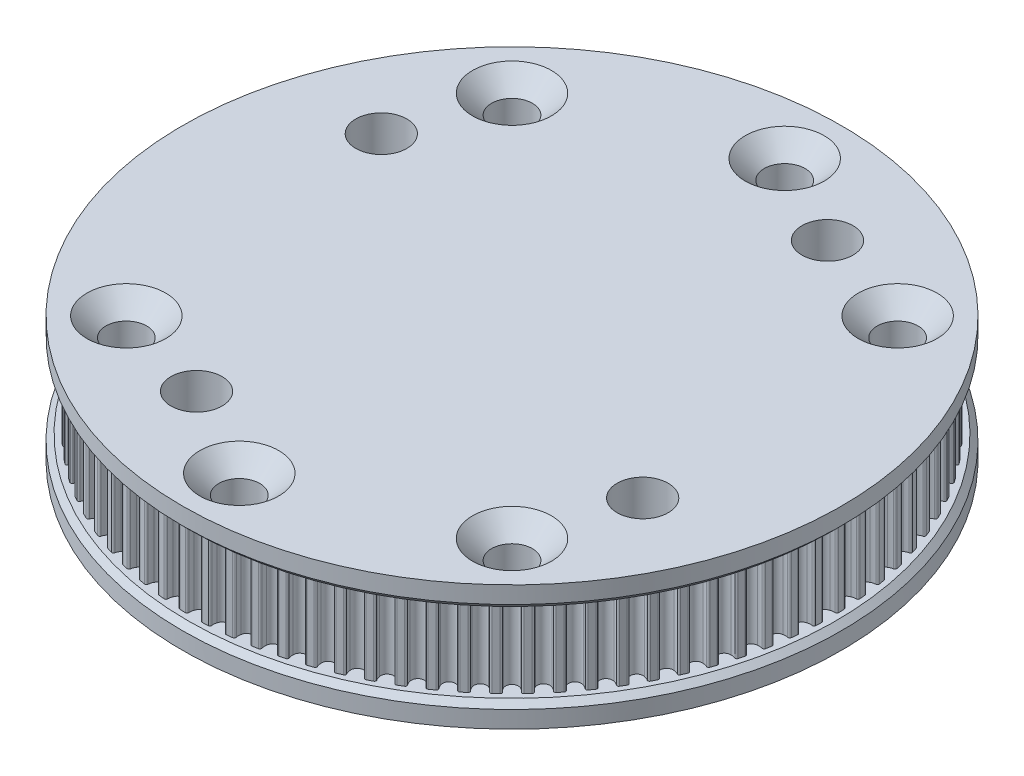
from build123d import *

# Parameters (mm, degrees)
SKETCH1_R                                            = 28.01
BOSS_EXTRUDE1_DEPTH                                  = 11
CSK_FOR_M3_HEX_SOCKET_COUNTERSUNK_HEAD_S_D           = 3.6
CSK_FOR_M3_HEX_SOCKET_COUNTERSUNK_HEAD_S_CSINK_D     = 6.94
CSK_FOR_M3_HEX_SOCKET_COUNTERSUNK_HEAD_S_CSINK_ANGLE = 90
F_4_5_4_5_DIAMETER_HOLE1_D                           = 4.5
CUT_EXTRUDE1_START                                   = -9
CUT_EXTRUDE1_DEPTH                                   = 7
CIRPATTERN1_COUNT                                    = 88
BOSS_EXTRUDE2_START                                  = -2
SKETCH10_R                                           = 29
SKETCH10_R_2                                         = 28.01
BOSS_EXTRUDE2_DEPTH                                  = 2
BOSS_EXTRUDE3_START                                  = -2
BOSS_EXTRUDE3_OUTLINE_R                              = 29
BOSS_EXTRUDE3_OUTLINE_R_2                            = 28.01
BOSS_EXTRUDE3_DEPTH                                  = 2
CHAMFER1_SIZE                                        = 0.5


# Read off the part's stored shape, not the designer's step: Boss-Extrude3
with BuildPart() as part:
    # Sketch1 → Boss-Extrude1 (new body)
    with BuildSketch(Plane(origin=(0, 0, 0), x_dir=(1, 0, 0), z_dir=(0, 1, 0))):
        with Locations(Location((0, 0, 0), (0, 0, 270))):
            Circle(SKETCH1_R)
    extrude(amount=BOSS_EXTRUDE1_DEPTH)

    # CSK for M3 Hex Socket Countersunk Head Screw1 (through all)
    with Locations(Plane(origin=(0, 11, 0), x_dir=(1, 0, 0), z_dir=(0, 1, 0))):
        with Locations((0, 24), (16.970562748, 16.970562748), (16.970562748, -16.970562748), (0, -24), (-16.970562748, -16.970562748), (-16.970562748, 16.970562748)):
            CounterSinkHole(CSK_FOR_M3_HEX_SOCKET_COUNTERSUNK_HEAD_S_D / 2, CSK_FOR_M3_HEX_SOCKET_COUNTERSUNK_HEAD_S_CSINK_D / 2, counter_sink_angle=CSK_FOR_M3_HEX_SOCKET_COUNTERSUNK_HEAD_S_CSINK_ANGLE)

    # Ø4.5 (4.5) Diameter Hole1 (through all)
    with Locations(Plane(origin=(0, 11, 0), x_dir=(1, 0, 0), z_dir=(0, 1, 0))):
        with Locations((-19.632440066, 8.132022938), (8.132022938, 19.632440066), (19.632440066, -8.132022938), (-8.132022938, -19.632440066)):
            Hole(F_4_5_4_5_DIAMETER_HOLE1_D / 2)

    # Sketch8 → Cut-Extrude1 (cut)
    with BuildSketch(Plane(origin=(0, 11, 0), x_dir=(1, 0, 0), z_dir=(0, 1, 0)).offset(CUT_EXTRUDE1_START)):
        with BuildLine():
            ThreePointArc((-0.594963582, 27.837275992), (-0.591056178, 27.629514383), (-0.544294273, 27.427045921))
            ThreePointArc((-0.544294273, 27.427045921), (-0.541669173, 27.427461817), (-0.539043755, 27.427875702))
            ThreePointArc((-0.539043755, 27.427875702), (0, 27.005), (0.539043755, 27.427875702))
            ThreePointArc((0.539043755, 27.427875702), (0.541669173, 27.427461817), (0.544294273, 27.427045921))
            ThreePointArc((0.544294273, 27.427045921), (0.591056178, 27.629514383), (0.594963582, 27.837275992))
            ThreePointArc((0.594963582, 27.837275992), (0.635292766, 27.952968247), (0.748426429, 27.999999248))
            ThreePointArc((0.748426429, 27.999999248), (-2e-09, 28.01), (-0.748426433, 27.999999248))
            ThreePointArc((-0.748426433, 27.999999248), (-0.635292767, 27.952968248), (-0.594963582, 27.837275992))
        make_face()
    cut_extrude1 = extrude(amount=CUT_EXTRUDE1_DEPTH, mode=Mode.SUBTRACT)

    # CirPattern1: Cut-Extrude1 ×88 about axis
    cirpattern1_axis = Axis((0, 0, 0), (0, 1, 0))
    for i in range(1, CIRPATTERN1_COUNT):
        add(cut_extrude1.rotate(cirpattern1_axis, i * 360 / CIRPATTERN1_COUNT), mode=Mode.SUBTRACT)

    # Sketch10 → Boss-Extrude2 (add)
    with BuildSketch(Plane(origin=(0, 11, 0), x_dir=(1, 0, 0), z_dir=(0, 1, 0)).offset(BOSS_EXTRUDE2_START)):
        with Locations(Location((0, 0, 0), (0, 0, 270))):
            Circle(SKETCH10_R)
        with Locations(Location((0, 0, 0), (0, 0, 91.531123884))):
            Circle(SKETCH10_R_2, mode=Mode.SUBTRACT)
    extrude(amount=BOSS_EXTRUDE2_DEPTH)

    # Boss-Extrude3 outline → Boss-Extrude3 (add)
    with BuildSketch(Plane.XZ.offset(BOSS_EXTRUDE3_START)):
        Circle(BOSS_EXTRUDE3_OUTLINE_R)
        Circle(BOSS_EXTRUDE3_OUTLINE_R_2, mode=Mode.SUBTRACT)
    extrude(amount=BOSS_EXTRUDE3_DEPTH)

    # Chamfer1
    chamfer1_edges = [part.edges().sort_by_distance(p)[0] for p in [
        (0, 9, -29),
        (-29, 2, 0),
    ]]
    chamfer(chamfer1_edges, length=CHAMFER1_SIZE)


solid = part.part
